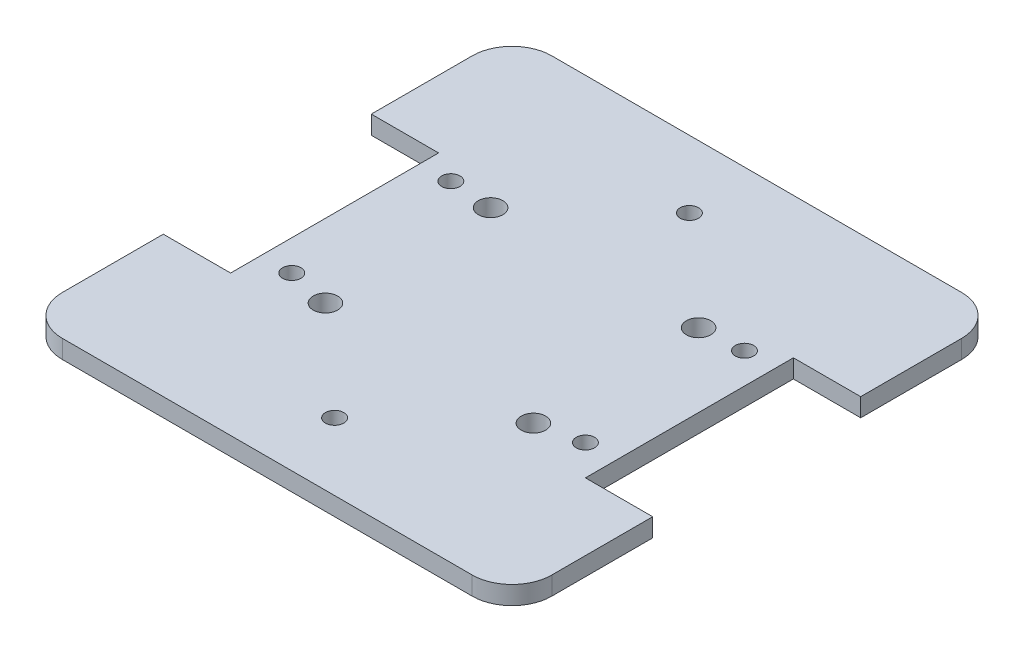
from build123d import *

# Parameters (mm, degrees)
SKETCH1_R           = 1.5
SKETCH1_R_2         = 2
BOSS_EXTRUDE1_DEPTH = 3


with BuildPart() as part:
    # Sketch1 → Boss-Extrude1 (new body)
    with BuildSketch(Plane(origin=(0, 0, 0), x_dir=(1, 0, 0), z_dir=(0, 1, 0))):
        with BuildLine():
            Line((6.5, 0), (73.5, 0))
            ThreePointArc((73.5, 0), (78.096194078, 1.903805922), (80, 6.5))
            Line((80, 6.5), (80, 23))
            Line((80, 23), (69, 23))
            Line((69, 23), (69, 57))
            Line((69, 57), (80, 57))
            Line((80, 57), (80, 73.5))
            ThreePointArc((80, 73.5), (78.096194078, 78.096194078), (73.5, 80))
            Line((73.5, 80), (6.5, 80))
            ThreePointArc((6.5, 80), (1.903805922, 78.096194078), (0, 73.5))
            Line((0, 73.5), (0, 57))
            Line((0, 57), (11, 57))
            Line((11, 57), (11, 23))
            Line((11, 23), (0, 23))
            Line((0, 23), (0, 6.5))
            ThreePointArc((0, 6.5), (1.903805922, 1.903805922), (6.5, 0))
        make_face()
        with Locations((16, 54)):
            Circle(SKETCH1_R, mode=Mode.SUBTRACT)
        with Locations((16, 28)):
            Circle(SKETCH1_R, mode=Mode.SUBTRACT)
        with Locations((64, 28)):
            Circle(SKETCH1_R, mode=Mode.SUBTRACT)
        with Locations((64, 54)):
            Circle(SKETCH1_R, mode=Mode.SUBTRACT)
        with Locations((23, 53.5)):
            Circle(SKETCH1_R_2, mode=Mode.SUBTRACT)
        with Locations((23, 26.5)):
            Circle(SKETCH1_R_2, mode=Mode.SUBTRACT)
        with Locations((57, 26.5)):
            Circle(SKETCH1_R_2, mode=Mode.SUBTRACT)
        with Locations((57, 53.5)):
            Circle(SKETCH1_R_2, mode=Mode.SUBTRACT)
        with Locations((40, 69)):
            Circle(SKETCH1_R, mode=Mode.SUBTRACT)
        with Locations((40, 11)):
            Circle(SKETCH1_R, mode=Mode.SUBTRACT)
    extrude(amount=BOSS_EXTRUDE1_DEPTH)


solid = part.part
